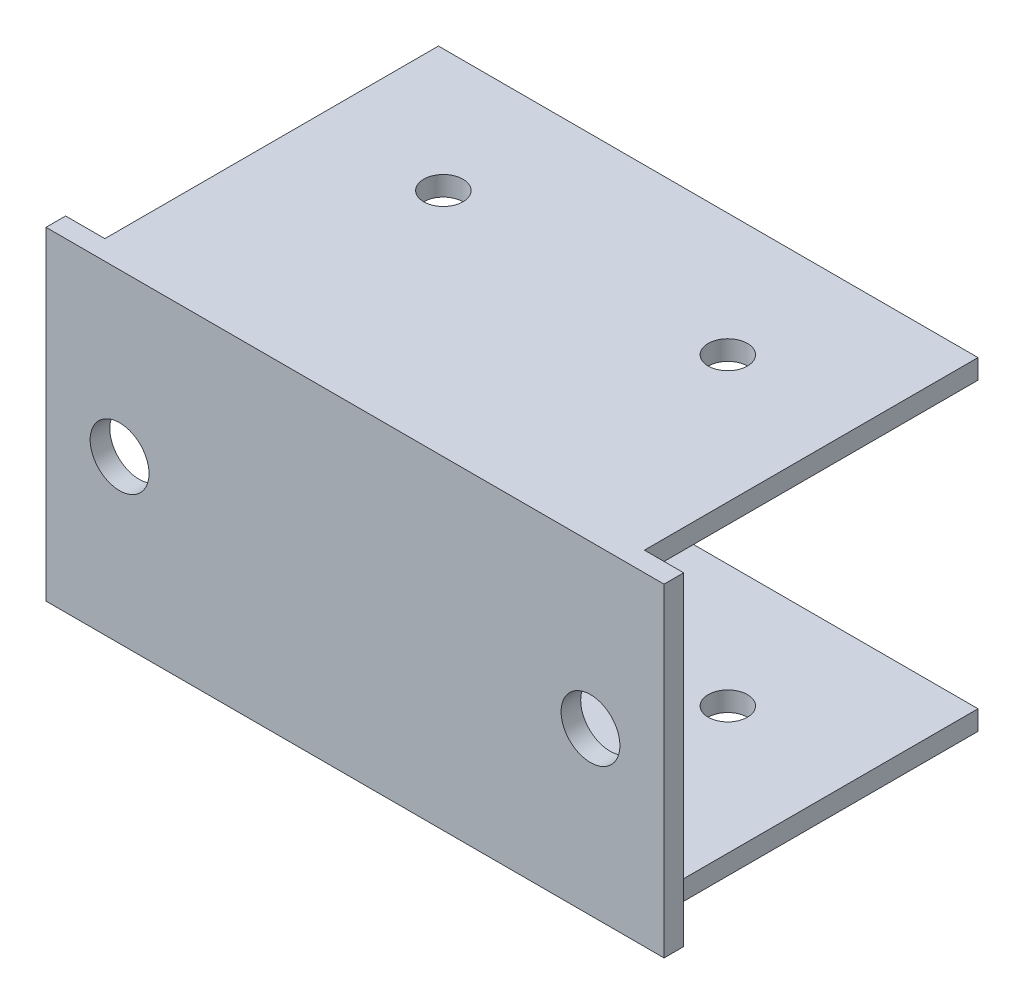
from build123d import *

# Parameters (mm, degrees)
SKETCH_1_W          = 63
SKETCH_1_H          = 33
EXTRUDE_1_DEPTH     = 2
SKETCH_2_R          = 3
CUT_EXTRUDE_1_DEPTH = 10
SKETCH_4_W          = 55
SKETCH_4_H          = 36
EXTRUDE_2_DEPTH     = 2
SKETCH_5_R          = 2
CUT_EXTRUDE_2_DEPTH = 57.896836467


with BuildPart() as part:
    # 草图1 → 凸台-拉伸1 (new body)
    with BuildSketch(Plane.XY):
        Rectangle(SKETCH_1_W, SKETCH_1_H)
    extrude(amount=EXTRUDE_1_DEPTH)

    # 草图2 → 切除-拉伸1 (cut)
    with BuildSketch(Plane.XY.offset(2)):
        with Locations((-24, 0)):
            Circle(SKETCH_2_R)
        with Locations((24, 0)):
            Circle(SKETCH_2_R)
    extrude(amount=-CUT_EXTRUDE_1_DEPTH, mode=Mode.SUBTRACT)

    # 草图4 → 凸台-拉伸2 (add)
    with BuildSketch(Plane(origin=(0, 16.5, 0), x_dir=(1, 0, 0), z_dir=(0, 1, 0))):
        with Locations((0, 16)):
            Rectangle(SKETCH_4_W, SKETCH_4_H)
    extrude_2 = extrude(amount=-EXTRUDE_2_DEPTH)

    # 草图5 → 切除-拉伸2 (cut, through all)
    with BuildSketch(Plane(origin=(0, 16.5, 0), x_dir=(1, 0, 0), z_dir=(0, 1, 0))):
        with Locations((-14.5, 21.5)):
            Circle(SKETCH_5_R)
        with Locations((14.5, 21.5)):
            Circle(SKETCH_5_R)
    cut_extrude_2 = extrude(amount=-CUT_EXTRUDE_2_DEPTH, mode=Mode.SUBTRACT)

    # 镜向1: 凸台-拉伸2, 切除-拉伸2 across plane
    add(extrude_2.mirror(Plane.ZX))
    add(cut_extrude_2.mirror(Plane.ZX), mode=Mode.SUBTRACT)


solid = part.part
